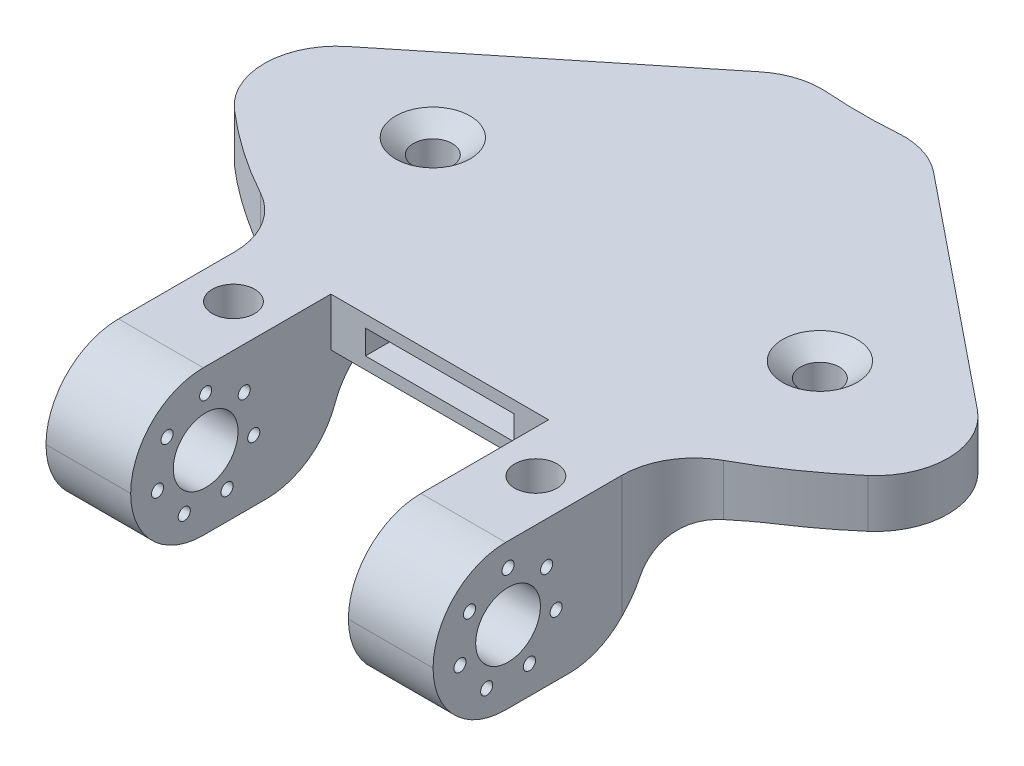
from build123d import *

# Parameters (mm, degrees)
BOSS_EXTRUDE1_DEPTH                               = 19.05
CUT_EXTRUDE1_DEPTH                                = 115.908159638
CUT_EXTRUDE1_DEPTH_BACK                           = 115.908159638
SKETCH2_R                                         = 4.25
FILLET1_R                                         = 9.525
CUT_EXTRUDE2_DEPTH                                = 12.7
FILLET2_R                                         = 9.525
FILLET3_R                                         = 9.525
PLATEMOUNT_CSK_FOR_10_FLAT_HEAD_MACHI_D           = 5.1054
PLATEMOUNT_CSK_FOR_10_FLAT_HEAD_MACHI_CSINK_D     = 9.779
PLATEMOUNT_CSK_FOR_10_FLAT_HEAD_MACHI_CSINK_ANGLE = 100
MAGNETPILOTHOLES_DEPTH                            = 102.387205266
MAGNETPILOTHOLES_DEPTH_BACK                       = 102.387205266
SKETCH6_R                                         = 2.778125
SKETCH7_R                                         = 0.79375
CONCENTRICSPRING_DEPTH                            = 115.908159655
SKETCH8_W                                         = 19.506154332
SKETCH8_H                                         = 3.175
FLATSPRING_DEPTH                                  = 12.7


# Some blends are built 0.0001 mm under size
with BuildPart() as part:
    # Sketch1 → Boss-Extrude1 (new body)
    with BuildSketch(Plane(origin=(0, 0, 0), x_dir=(1, 0, 0), z_dir=(0, 1, 0))):
        with BuildLine():
            Line((-41.329414278, -33.383446728), (-11.39787131, -9.206523643))
            ThreePointArc((-11.39787131, -9.206523643), (-8.251464968, -7.524083169), (-4.706733668, -7.117439797))
            ThreePointArc((-4.706733668, -7.117439797), (0, -7.292115809), (4.706733668, -7.117439797))
            ThreePointArc((4.706733668, -7.117439797), (8.251464968, -7.524083169), (11.39787131, -9.206523643))
            Line((11.39787131, -9.206523643), (41.329414278, -33.383446728))
            ThreePointArc((41.329414278, -33.383446728), (44.867868706, -40.628812733), (41.581513749, -47.991954684))
            ThreePointArc((41.581513749, -47.991954684), (36.18496399, -52.181398803), (30.369565217, -55.766831616))
            ThreePointArc((30.369565217, -55.766831616), (26.736100767, -59.266925285), (25.4, -64.131856359))
            Line((25.4, -64.131856359), (25.4, -88.9))
            Line((25.4, -88.9), (14.2875, -88.9))
            Line((14.2875, -88.9), (14.2875, -62.624069529))
            Line((14.2875, -62.624069529), (-14.2875, -62.624069529))
            Line((-14.2875, -62.624069529), (-14.2875, -88.9))
            Line((-14.2875, -88.9), (-25.4, -88.9))
            Line((-25.4, -88.9), (-25.4, -64.131856359))
            ThreePointArc((-25.4, -64.131856359), (-26.736100767, -59.266925285), (-30.369565217, -55.766831616))
            ThreePointArc((-30.369565217, -55.766831616), (-36.18496399, -52.181398803), (-41.581513749, -47.991954684))
            ThreePointArc((-41.581513749, -47.991954684), (-44.867868706, -40.628812733), (-41.329414278, -33.383446728))
        make_face()
    extrude(amount=BOSS_EXTRUDE1_DEPTH)

    # Sketch2 → Cut-Extrude1 (cut, two sides: drawn at the far end of the back side and taken through both)
    with BuildSketch(Plane.ZY.offset(25.4).offset(-CUT_EXTRUDE1_DEPTH_BACK)):
        with Locations((79.0575, 9.525)):
            Circle(SKETCH2_R)
    extrude(amount=CUT_EXTRUDE1_DEPTH + CUT_EXTRUDE1_DEPTH_BACK, mode=Mode.SUBTRACT)

    # Fillet1
    fillet1_edges = [part.edges().sort_by_distance(p)[0] for p in [
        (19.84375, 0, 88.9),
        (-19.84375, 0, 88.9),
        (19.84375, 19.05, 88.9),
        (-19.84375, 19.05, 88.9),
    ]]
    fillet(fillet1_edges, radius=FILLET1_R - 0.0001)  # a hair under: the kernel refuses the full size

    # Sketch3 → Cut-Extrude2 (cut)
    with BuildSketch(Plane.XZ):
        with BuildLine():
            ThreePointArc((30.369565217, 55.766831616), (27.148227728, 58.63208927), (25.520096817, 62.624069529))
            Line((25.520096817, 62.624069529), (14.2875, 62.624069529))
            Line((14.2875, 62.624069529), (-14.2875, 62.624069529))
            Line((-14.2875, 62.624069529), (-25.520096817, 62.624069529))
            ThreePointArc((-25.520096817, 62.624069529), (-27.148227728, 58.63208927), (-30.369565217, 55.766831616))
            ThreePointArc((-30.369565217, 55.766831616), (-36.18496399, 52.181398803), (-41.581513749, 47.991954684))
            ThreePointArc((-41.581513749, 47.991954684), (-44.867868706, 40.628812733), (-41.329414278, 33.383446728))
            Line((-41.329414278, 33.383446728), (-11.39787131, 9.206523643))
            ThreePointArc((-11.39787131, 9.206523643), (-8.251464968, 7.524083169), (-4.706733668, 7.117439797))
            ThreePointArc((-4.706733668, 7.117439797), (0, 7.292115809), (4.706733668, 7.117439797))
            ThreePointArc((4.706733668, 7.117439797), (8.251464968, 7.524083169), (11.39787131, 9.206523643))
            Line((11.39787131, 9.206523643), (41.329414278, 33.383446728))
            ThreePointArc((41.329414278, 33.383446728), (44.867868706, 40.628812733), (41.581513749, 47.991954684))
            ThreePointArc((41.581513749, 47.991954684), (36.18496399, 52.181398803), (30.369565217, 55.766831616))
        make_face()
    extrude(amount=-CUT_EXTRUDE2_DEPTH, mode=Mode.SUBTRACT)

    # Fillet2
    fillet2_edges = [part.edges().sort_by_distance(p)[0] for p in [
        (19.903798409, 12.7, 62.624069529),
        (-19.903798409, 12.7, 62.624069529),
    ]]
    fillet(fillet2_edges, radius=FILLET2_R)

    # Fillet3
    # the kernel refuses this fillet: 9.525 mm, written as the material it takes off along each edge
    with BuildSketch(Plane(origin=(-46.608877423, 0, 62.624069529), x_dir=(0, 0.9963405296085162, -0.08547250469841931), z_dir=(1, 0, 0)), Plane(origin=(-6.801280605, 0, 62.624069529), x_dir=(0, 0.9963405296085163, -0.08547250469841931), z_dir=(1, 0, 0))) as fillet3_piece_1:
        with BuildLine():
            CenterArc((8.769139185, 9.218768342), FILLET3_R, 184.903196278, 70.528779366)
            Line((-0.72100436, 8.404642735), (-1.670018714, 8.323230174))
            Line((-1.670018714, 8.323230174), (-0.949014354, -0.081412561))
            Line((-0.949014354, -0.081412561), (0.081412561, -0.949014354))
            ThreePointArc((0.081412561, -0.949014354), (3.244793742, -0.677639152), (6.133741367, -0.921876834))
            Line((6.133741367, -0.921876834), (6.373322987, 0))
        make_face()
    extrude(amount=53.410158028, mode=Mode.SUBTRACT)

    # PlateMount - CSK for #10 Flat Head Machine Screw (100)2 (through all)
    with Locations(Plane(origin=(0, 19.05, 0), x_dir=(1, 0, 0), z_dir=(0, 1, 0))):
        with Locations((-25.4, -38.133092669), (25.4, -38.133092669)):
            CounterSinkHole(PLATEMOUNT_CSK_FOR_10_FLAT_HEAD_MACHI_D / 2, PLATEMOUNT_CSK_FOR_10_FLAT_HEAD_MACHI_CSINK_D / 2, counter_sink_angle=PLATEMOUNT_CSK_FOR_10_FLAT_HEAD_MACHI_CSINK_ANGLE)

    # Sketch6 → MagnetPilotHoles (cut, two sides: drawn at the far end of the back side and taken through both)
    with BuildSketch(Plane.XZ.offset(-MAGNETPILOTHOLES_DEPTH_BACK)):
        with Locations(Location((-19.84375, 69.85, 0), (0, 0, 270))):
            Circle(SKETCH6_R)
        with Locations(Location((19.84375, 69.85, 0), (0, 0, 154.189568172))):
            Circle(SKETCH6_R)
    extrude(amount=MAGNETPILOTHOLES_DEPTH + MAGNETPILOTHOLES_DEPTH_BACK, mode=Mode.SUBTRACT)

    # Sketch7 → ConcentricSpring (cut, through all)
    with BuildSketch(Plane.ZY.offset(25.4)):
        with Locations((79.0575, 15.9975)):
            Circle(SKETCH7_R)
        with Locations((84.11790427, 13.560537743)):
            Circle(SKETCH7_R)
        with Locations((85.367720912, 8.084733255)):
            Circle(SKETCH7_R)
        with Locations((81.865812501, 3.693479003)):
            Circle(SKETCH7_R)
        with Locations((76.249187499, 3.693479003)):
            Circle(SKETCH7_R)
        with Locations((72.747279088, 8.084733255)):
            Circle(SKETCH7_R)
        with Locations((73.99709573, 13.560537743)):
            Circle(SKETCH7_R)
    extrude(amount=-CONCENTRICSPRING_DEPTH, mode=Mode.SUBTRACT)

    # Sketch8 → FlatSpring (cut)
    with BuildSketch(Plane.XY.offset(62.624069529)):
        with Locations((0, 15.875)):
            Rectangle(SKETCH8_W, SKETCH8_H)
    extrude(amount=-FLATSPRING_DEPTH, mode=Mode.SUBTRACT)


solid = part.part
